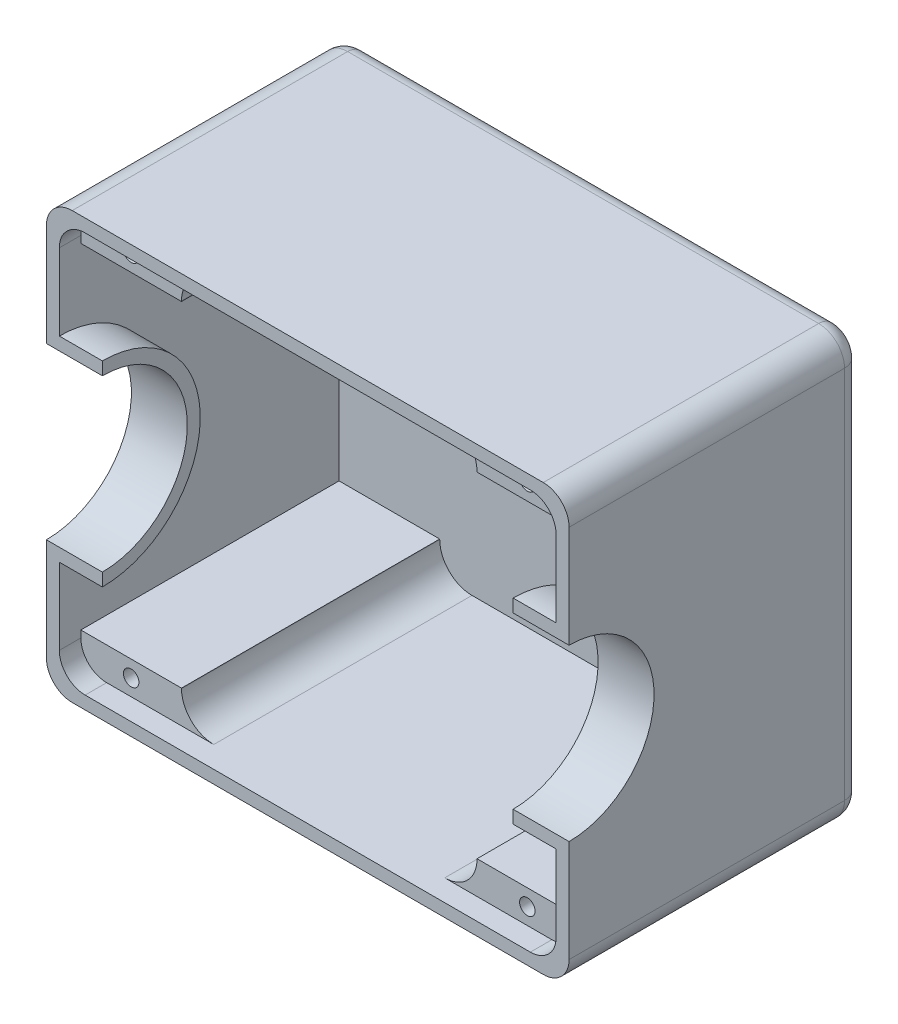
from build123d import *
from build123d.topology import SkipClean

# Parameters (mm, degrees)
BOSS_EXTRUDE1_DEPTH = 65
BOSS_EXTRUDE3_START = 3
BOSS_EXTRUDE3_DEPTH = 3
SKETCH4_R           = 19.75
CUT_EXTRUDE1_DEPTH  = 132
SKETCH8_R           = 1.8
BOSS_EXTRUDE6_DEPTH = 60
FILLET1_R           = 7.5
FILLET2_R           = 7.5
FILLET3_R           = 7.5
FILLET4_R           = 7.5
BOSS_EXTRUDE8_DEPTH = 10
FILLET8_R           = 4
CUT_EXTRUDE2_START  = -40
SKETCH13_R          = 1.8
CUT_EXTRUDE2_DEPTH  = 40
SKETCH14_R          = 2.75
CUT_EXTRUDE3_DEPTH  = 3
CUT_EXTRUDE4_DEPTH  = 11.8
SKETCH16_R          = 2.5
CUT_EXTRUDE5_DEPTH  = 12.8
SKETCH18_W          = 9.402156545
SKETCH18_H          = 47.685659657
SKETCH18_W_2        = 10.670772927
CUT_EXTRUDE6_DEPTH  = 23.8


with BuildPart() as part:
    # Sketch1 → Boss-Extrude1 (new body)
    with BuildSketch(Plane(origin=(0, 0, 0), x_dir=(0, 1, 0), z_dir=(0, 0, 1))):
        with BuildLine():
            ThreePointArc((-43.5, 60.724137931), (-47.742640687, 58.966778618), (-49.5, 54.724137931))
            Line((-49.5, 54.724137931), (-49.5, -54.724137931))
            ThreePointArc((-49.5, -54.724137931), (-47.742640687, -58.966778618), (-43.5, -60.724137931))
            Line((-43.5, -60.724137931), (43.5, -60.724137931))
            ThreePointArc((43.5, -60.724137931), (47.742640687, -58.966778618), (49.5, -54.724137931))
            Line((49.5, -54.724137931), (49.5, 54.724137931))
            ThreePointArc((49.5, 54.724137931), (47.742640687, 58.966778618), (43.5, 60.724137931))
            Line((43.5, 60.724137931), (-43.5, 60.724137931))
        make_face()
        with BuildLine():
            ThreePointArc((-46.5, 51.724137931), (-44.742640687, 55.966778618), (-40.5, 57.724137931))
            Line((-40.5, 57.724137931), (40.5, 57.724137931))
            ThreePointArc((40.5, 57.724137931), (44.742640687, 55.966778618), (46.5, 51.724137931))
            Line((46.5, 51.724137931), (46.5, -51.724137931))
            ThreePointArc((46.5, -51.724137931), (44.742640687, -55.966778618), (40.5, -57.724137931))
            Line((40.5, -57.724137931), (-40.5, -57.724137931))
            ThreePointArc((-40.5, -57.724137931), (-44.742640687, -55.966778618), (-46.5, -51.724137931))
            Line((-46.5, -51.724137931), (-46.5, 51.724137931))
        make_face(mode=Mode.SUBTRACT)
    extrude(amount=BOSS_EXTRUDE1_DEPTH)

    # Sketch3 → Boss-Extrude3 (add)
    with BuildSketch(Plane(origin=(0, 0, 0), x_dir=(1, 0, 0), z_dir=(0, 0, -1)).offset(BOSS_EXTRUDE3_START)):
        with BuildLine():
            Line((-54.724137931, 49.5), (54.724137931, 49.5))
            ThreePointArc((54.724137931, 49.5), (58.966778618, 47.742640687), (60.724137931, 43.5))
            Line((60.724137931, 43.5), (60.724137931, -43.5))
            ThreePointArc((60.724137931, -43.5), (58.966778618, -47.742640687), (54.724137931, -49.5))
            Line((54.724137931, -49.5), (-54.724137931, -49.5))
            ThreePointArc((-54.724137931, -49.5), (-58.966778618, -47.742640687), (-60.724137931, -43.5))
            Line((-60.724137931, -43.5), (-60.724137931, 43.5))
            ThreePointArc((-60.724137931, 43.5), (-58.966778618, 47.742640687), (-54.724137931, 49.5))
        make_face()
    extrude(amount=-BOSS_EXTRUDE3_DEPTH)

    # Sketch4 → Cut-Extrude1 (cut)
    with BuildSketch(Plane.YZ.offset(60.724137931)):
        with Locations((0, 65)):
            Circle(SKETCH4_R)
    extrude(amount=-CUT_EXTRUDE1_DEPTH, mode=Mode.SUBTRACT)

    # Sketch8 → Boss-Extrude6 (add)
    # profile 1 of 4: a face of its own
    with BuildSketch(Plane.XY):
        with BuildLine():
            Line((-34.332324886, 46.5), (-51.724137931, 46.5))
            ThreePointArc((-51.724137931, 46.5), (-55.966778618, 44.742640687), (-57.724137931, 40.5))
            Line((-57.724137931, 40.5), (-57.724137931, 38.9))
            Line((-57.724137931, 38.9), (-34.332324886, 38.9))
            Line((-34.332324886, 38.9), (-34.332324886, 46.5))
        make_face()
        with Locations((-46.028231409, 42.7)):
            Circle(SKETCH8_R, mode=Mode.SUBTRACT)
    # profile 2 of 4: a face of its own
    with BuildSketch(Plane.XY):
        with BuildLine():
            Line((51.724137931, 46.5), (34.332324886, 46.5))
            Line((34.332324886, 46.5), (34.332324886, 38.9))
            Line((34.332324886, 38.9), (57.724137931, 38.9))
            Line((57.724137931, 38.9), (57.724137931, 40.5))
            ThreePointArc((57.724137931, 40.5), (55.966778618, 44.742640687), (51.724137931, 46.5))
        make_face()
        with Locations((46.028231409, 42.7)):
            Circle(SKETCH8_R, mode=Mode.SUBTRACT)
    # profile 3 of 4: a face of its own
    with BuildSketch(Plane.XY):
        with BuildLine():
            Line((-34.332324886, -38.9), (-57.724137931, -38.9))
            Line((-57.724137931, -38.9), (-57.724137931, -40.5))
            ThreePointArc((-57.724137931, -40.5), (-55.966778618, -44.742640687), (-51.724137931, -46.5))
            Line((-51.724137931, -46.5), (-34.332324886, -46.5))
            Line((-34.332324886, -46.5), (-34.332324886, -38.9))
        make_face()
        with Locations((-46.028231409, -42.7)):
            Circle(SKETCH8_R, mode=Mode.SUBTRACT)
    # profile 4 of 4: a face of its own
    with BuildSketch(Plane.XY):
        with BuildLine():
            Line((57.724137931, -40.5), (57.724137931, -38.9))
            Line((57.724137931, -38.9), (34.332324886, -38.9))
            Line((34.332324886, -38.9), (34.332324886, -46.5))
            Line((34.332324886, -46.5), (51.724137931, -46.5))
            ThreePointArc((51.724137931, -46.5), (55.966778618, -44.742640687), (57.724137931, -40.5))
        make_face()
        with Locations((46.028231409, -42.7)):
            Circle(SKETCH8_R, mode=Mode.SUBTRACT)
    extrude(amount=BOSS_EXTRUDE6_DEPTH)

    # Fillet1
    fillet1_edges = [part.edges().sort_by_distance(p)[0] for p in [
        (-34.332324886, 46.5, 30),
    ]]
    fillet(fillet1_edges, radius=FILLET1_R)

    # Fillet2
    fillet2_edges = [part.edges().sort_by_distance(p)[0] for p in [
        (34.332324886, 46.5, 30),
    ]]
    fillet(fillet2_edges, radius=FILLET2_R)

    # Fillet3
    fillet3_edges = [part.edges().sort_by_distance(p)[0] for p in [
        (-34.332324886, -46.5, 30),
    ]]
    fillet(fillet3_edges, radius=FILLET3_R)

    # Fillet4
    fillet4_edges = [part.edges().sort_by_distance(p)[0] for p in [
        (34.332324886, -46.5, 30),
    ]]
    fillet(fillet4_edges, radius=FILLET4_R)

    # Sketch12 → Boss-Extrude8 (add, symmetric)
    with SkipClean():  # the faces are left unmerged after this step: merging them gives an invalid solid
        with BuildSketch(Plane(origin=(57.724137931, 0, 0), x_dir=(0, -1, 0), z_dir=(-1, 0, 0))):
            with BuildLine():
                Line((-19.75, 65), (-22.75, 65))
                ThreePointArc((-22.75, 65), (0, 42.25), (22.75, 65))
                Line((22.75, 65), (19.75, 65))
                ThreePointArc((19.75, 65), (0, 45.25), (-19.75, 65))
            make_face()
        boss_extrude8 = extrude(amount=BOSS_EXTRUDE8_DEPTH, both=True)
    add(part.part.scale(1), mode=Mode.REPLACE)  # the faces are merged on a copy

    # Mirror2: Boss-Extrude8 across plane
    add(boss_extrude8.mirror(Plane(origin=(0, 0, 0), x_dir=(0, 0, 1), z_dir=(1, 0, 0))))

    # Fillet8
    fillet8_edges = [part.edges().sort_by_distance(p)[0] for p in [
        (-60.724137931, 0, -3),
    ]]
    fillet(fillet8_edges, radius=FILLET8_R)

    # Sketch13 → Cut-Extrude2 (cut)
    with BuildSketch(Plane.XY.offset(CUT_EXTRUDE2_START)):
        with Locations((-46.028231409, 42.7)):
            Circle(SKETCH13_R)
        with Locations((46.028231409, 42.7)):
            Circle(SKETCH13_R)
        with Locations((-46.028231409, -42.7)):
            Circle(SKETCH13_R)
        with Locations((46.028231409, -42.7)):
            Circle(SKETCH13_R)
    extrude(amount=CUT_EXTRUDE2_DEPTH, mode=Mode.SUBTRACT)

    # Sketch14 → Cut-Extrude3 (cut)
    with BuildSketch(Plane(origin=(0, 0, -3), x_dir=(1, 0, 0), z_dir=(0, 0, -1))):
        with Locations((-46.028231409, 42.7)):
            Circle(SKETCH14_R)
        with Locations((-46.028231409, -42.7)):
            Circle(SKETCH14_R)
        with Locations((46.028231409, -42.7)):
            Circle(SKETCH14_R)
        with Locations((46.028231409, 42.7)):
            Circle(SKETCH14_R)
    extrude(amount=-CUT_EXTRUDE3_DEPTH, mode=Mode.SUBTRACT)

    # Sketch15 → Cut-Extrude4 (cut)
    with BuildSketch(Plane(origin=(-60.724137931, 0, 0), x_dir=(0, -1, 0), z_dir=(-1, 0, 0))):
        with BuildLine():
            Line((-34.5, 17.3), (-25.5, 17.3))
            ThreePointArc((-25.5, 17.3), (-24.085786438, 16.714213562), (-23.5, 15.3))
            Line((-23.5, 15.3), (-23.5, 8.3))
            ThreePointArc((-23.5, 8.3), (-24.085786438, 6.885786438), (-25.5, 6.3))
            Line((-25.5, 6.3), (-34.5, 6.3))
            ThreePointArc((-34.5, 6.3), (-35.914213562, 6.885786438), (-36.5, 8.3))
            Line((-36.5, 8.3), (-36.5, 15.3))
            ThreePointArc((-36.5, 15.3), (-35.914213562, 16.714213562), (-34.5, 17.3))
        make_face()
    extrude(amount=-CUT_EXTRUDE4_DEPTH, mode=Mode.SUBTRACT)

    # Sketch16 → Cut-Extrude5 (cut)
    with BuildSketch(Plane(origin=(-60.724137931, 0, 0), x_dir=(0, -1, 0), z_dir=(-1, 0, 0))):
        with Locations((-15.101265496, 11.8)):
            Circle(SKETCH16_R)
    extrude(amount=-CUT_EXTRUDE5_DEPTH, mode=Mode.SUBTRACT)

    # Sketch18 → Cut-Extrude6 (cut)
    with BuildSketch(Plane.XY.offset(65)):
        with Locations((-65.425216203, -1.092829829)):
            Rectangle(SKETCH18_W, SKETCH18_H)
        with Locations((66.059524395, -1.092829829)):
            Rectangle(SKETCH18_W_2, SKETCH18_H)
    extrude(amount=-CUT_EXTRUDE6_DEPTH, mode=Mode.SUBTRACT)


solid = part.part
